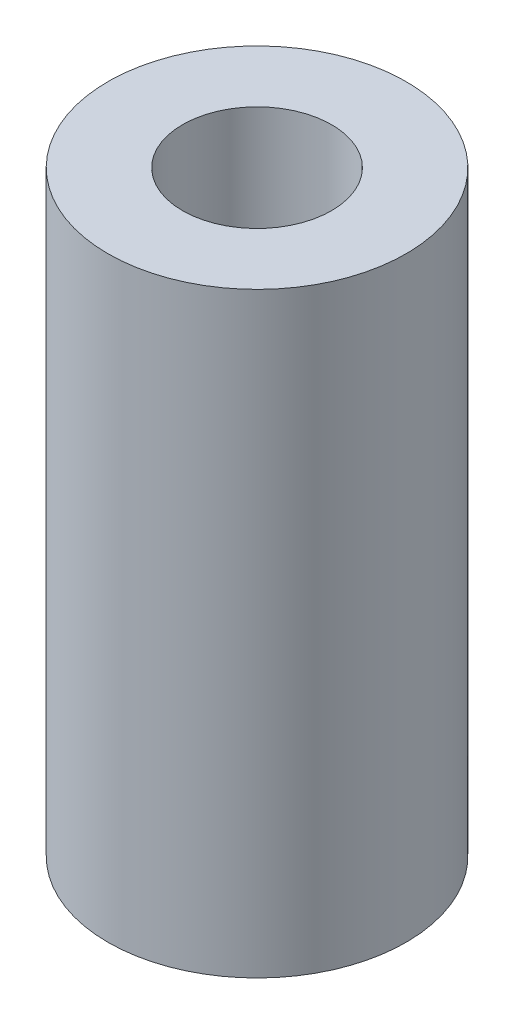
from build123d import *

# Parameters (mm, degrees)
SKETCH1_R             = 2.5
BOSS_EXTRUDE1_DEPTH   = 10
M3X0_5_TAPPED_HOLE1_D = 2.5


with BuildPart() as part:
    # Sketch1 → Boss-Extrude1 (new body)
    with BuildSketch(Plane(origin=(0, 0, 0), x_dir=(1, 0, 0), z_dir=(0, 1, 0))):
        Circle(SKETCH1_R)
    extrude(amount=BOSS_EXTRUDE1_DEPTH)

    # M3x0.5 Tapped Hole1 (through all)
    with Locations(Plane(origin=(0, 10, 0), x_dir=(1, 0, 0), z_dir=(0, 1, 0))):
        with Locations((0, 0)):
            Hole(M3X0_5_TAPPED_HOLE1_D / 2)


solid = part.part
